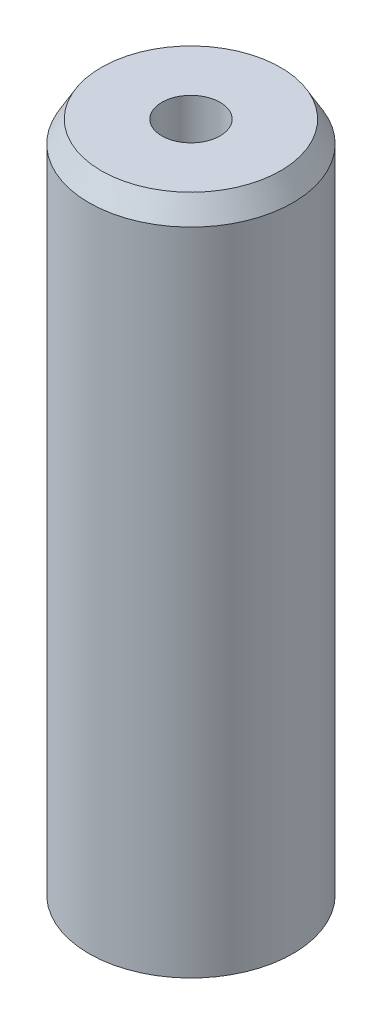
from build123d import *
from OCP.BRepFilletAPI import BRepFilletAPI_MakeChamfer

# Parameters (mm, degrees)
SKETCH1_R           = 10
BOSS_EXTRUDE1_DEPTH = 67.08091403
SKETCH2_R           = 2.857867368
CUT_EXTRUDE1_DEPTH  = 69.555444912
CHAMFER1_SIZE       = 2.102620972
CHAMFER1_SIZE2      = 1.213948784


with BuildPart() as part:
    # Sketch1 → Boss-Extrude1 (new body)
    with BuildSketch(Plane(origin=(0, 0, 0), x_dir=(1, 0, 0), z_dir=(0, 1, 0))):
        Circle(SKETCH1_R)
    extrude(amount=BOSS_EXTRUDE1_DEPTH)

    # Sketch2 → Cut-Extrude1 (cut, through all)
    with BuildSketch(Plane(origin=(0, 0, 0), x_dir=(1, 0, 0), z_dir=(0, 1, 0))):
        Circle(SKETCH2_R)
    extrude(amount=CUT_EXTRUDE1_DEPTH, mode=Mode.SUBTRACT)

    # Chamfer1: one chamfer whose edges measure the first distance from different faces: ONE call of the kernel's chamfer builder (chamfer() names one face for all edges)
    chamfer1_edges_1 = [part.edges().sort_by_distance(p)[0] for p in [
        (-10, 67.08091403, 0),
    ]]
    chamfer1_side_1 = [part.faces().sort_by_distance(p)[0] for p in [
        (-10, 33.540457015, 0),
    ]]
    chamfer1_edges_2 = [part.edges().sort_by_distance(p)[0] for p in [
        (-10, 0, 0),
    ]]
    chamfer1_side_2 = [part.faces().sort_by_distance(p)[0] for p in [
        (-9.717157288, 0, 0),
    ]]
    chamfer1 = BRepFilletAPI_MakeChamfer(part.part.solid().wrapped)
    for e in chamfer1_edges_1:
        chamfer1.Add(CHAMFER1_SIZE, CHAMFER1_SIZE2, e.wrapped, chamfer1_side_1[0].wrapped)  # the first distance lies on this face
    for e in chamfer1_edges_2:
        chamfer1.Add(CHAMFER1_SIZE, CHAMFER1_SIZE2, e.wrapped, chamfer1_side_2[0].wrapped)  # the first distance lies on this face
    add(Compound.cast(chamfer1.Shape()), mode=Mode.REPLACE)


solid = part.part
